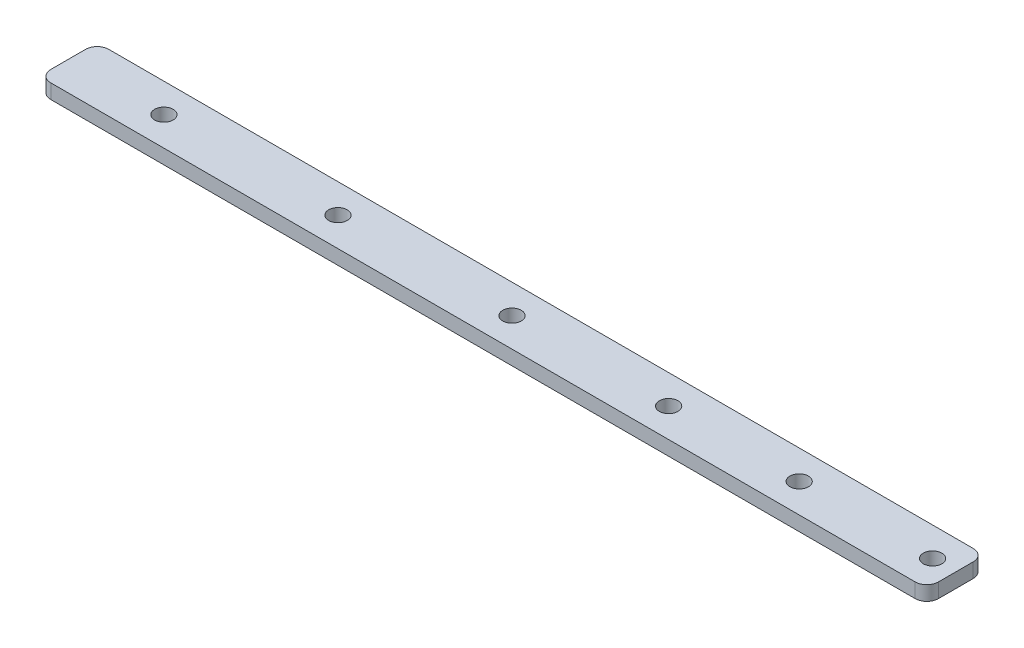
from build123d import *

# Parameters (mm, degrees)
SKETCH1_W           = 194.31
SKETCH1_H           = 12.7
BOSS_EXTRUDE1_DEPTH = 3.175
FILLET1_R           = 2.54
CUT_EXTRUDE1_REACH  = 99.414
SKETCH2_R           = 2.032


with BuildPart() as part:
    # Sketch1 → Boss-Extrude1 (new body)
    with BuildSketch(Plane(origin=(0, 0, 0), x_dir=(1, 0, 0), z_dir=(0, 1, 0))):
        Rectangle(SKETCH1_W, SKETCH1_H)
    extrude(amount=BOSS_EXTRUDE1_DEPTH)

    # Fillet1
    fillet1_edges = [part.edges().sort_by_distance(p)[0] for p in [
        (97.155, 1.5875, -6.35),
        (97.155, 1.5875, 6.35),
        (-97.155, 1.5875, 6.35),
        (-97.155, 1.5875, -6.35),
    ]]
    fillet(fillet1_edges, radius=FILLET1_R)

    # Sketch2 → Cut-Extrude1 (cut, up to next)
    with BuildSketch(Plane(origin=(0, 3.175, 0), x_dir=(1, 0, 0), z_dir=(0, 1, 0)), mode=Mode.PRIVATE) as cut_extrude1_sk1:
        with Locations((-76.2, 0)):
            Circle(SKETCH2_R)
    cut_extrude1_tool1 = extrude(cut_extrude1_sk1.sketch, amount=-CUT_EXTRUDE1_REACH, mode=Mode.PRIVATE) & part.part
    # Sketch2 → Cut-Extrude1 (cut, up to next)
    with BuildSketch(Plane(origin=(0, 3.175, 0), x_dir=(1, 0, 0), z_dir=(0, 1, 0)), mode=Mode.PRIVATE) as cut_extrude1_sk2:
        Circle(SKETCH2_R)
    cut_extrude1_tool2 = extrude(cut_extrude1_sk2.sketch, amount=-CUT_EXTRUDE1_REACH, mode=Mode.PRIVATE) & part.part
    # Sketch2 → Cut-Extrude1 (cut, up to next)
    with BuildSketch(Plane(origin=(0, 3.175, 0), x_dir=(1, 0, 0), z_dir=(0, 1, 0)), mode=Mode.PRIVATE) as cut_extrude1_sk3:
        with Locations((-38.1, 0)):
            Circle(SKETCH2_R)
    cut_extrude1_tool3 = extrude(cut_extrude1_sk3.sketch, amount=-CUT_EXTRUDE1_REACH, mode=Mode.PRIVATE) & part.part
    # Sketch2 → Cut-Extrude1 (cut, up to next)
    with BuildSketch(Plane(origin=(0, 3.175, 0), x_dir=(1, 0, 0), z_dir=(0, 1, 0)), mode=Mode.PRIVATE) as cut_extrude1_sk4:
        with Locations((92.075, 0)):
            Circle(SKETCH2_R)
    cut_extrude1_tool4 = extrude(cut_extrude1_sk4.sketch, amount=-CUT_EXTRUDE1_REACH, mode=Mode.PRIVATE) & part.part
    # Sketch2 → Cut-Extrude1 (cut, up to next)
    with BuildSketch(Plane(origin=(0, 3.175, 0), x_dir=(1, 0, 0), z_dir=(0, 1, 0)), mode=Mode.PRIVATE) as cut_extrude1_sk5:
        with Locations((62.865, 0)):
            Circle(SKETCH2_R)
    cut_extrude1_tool5 = extrude(cut_extrude1_sk5.sketch, amount=-CUT_EXTRUDE1_REACH, mode=Mode.PRIVATE) & part.part
    # Sketch2 → Cut-Extrude1 (cut, up to next)
    with BuildSketch(Plane(origin=(0, 3.175, 0), x_dir=(1, 0, 0), z_dir=(0, 1, 0)), mode=Mode.PRIVATE) as cut_extrude1_sk6:
        with Locations((34.29, 0)):
            Circle(SKETCH2_R)
    cut_extrude1_tool6 = extrude(cut_extrude1_sk6.sketch, amount=-CUT_EXTRUDE1_REACH, mode=Mode.PRIVATE) & part.part
    add(cut_extrude1_tool1.solids().sort_by_distance((-76.2, 3.175, 0))[0], mode=Mode.SUBTRACT)
    add(cut_extrude1_tool2.solids().sort_by_distance((0, 3.175, 0))[0], mode=Mode.SUBTRACT)
    add(cut_extrude1_tool3.solids().sort_by_distance((-38.1, 3.175, 0))[0], mode=Mode.SUBTRACT)
    add(cut_extrude1_tool4.solids().sort_by_distance((92.075, 3.175, 0))[0], mode=Mode.SUBTRACT)
    add(cut_extrude1_tool5.solids().sort_by_distance((62.865, 3.175, 0))[0], mode=Mode.SUBTRACT)
    add(cut_extrude1_tool6.solids().sort_by_distance((34.29, 3.175, 0))[0], mode=Mode.SUBTRACT)


solid = part.part
